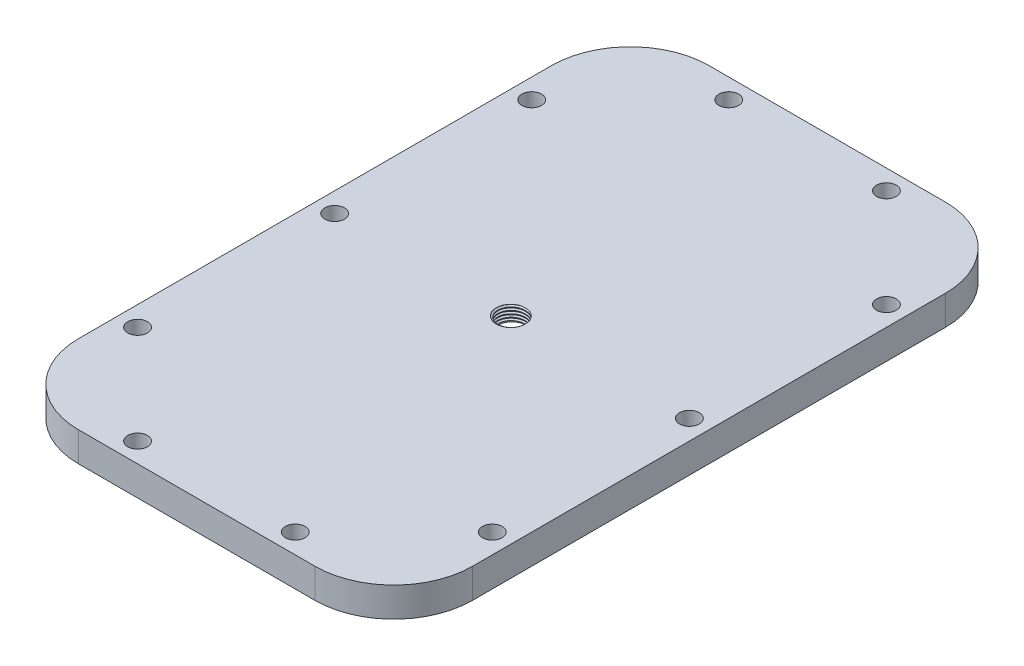
from build123d import *

# Parameters (mm, degrees)
BOSS_EXTRUDE1_DEPTH = 15
CUT_EXTRUDE1_DEPTH  = 7.5
SKETCH3_R           = 6.92
CUT_EXTRUDE2_DEPTH  = 7.5
SKETCH4_R           = 5
CUT_EXTRUDE3_DEPTH  = 15
THREAD1_PITCH       = 1.5


with BuildPart() as part:
    # Sketch1 → Boss-Extrude1 (new body)
    with BuildSketch(Plane(origin=(0, 0, 0), x_dir=(1, 0, 0), z_dir=(0, 1, 0))):
        with BuildLine():
            Line((-100, -120), (-100, 120))
            ThreePointArc((-100, 120), (-88.284271247, 148.284271247), (-60, 160))
            Line((-60, 160), (60, 160))
            ThreePointArc((60, 160), (88.284271247, 148.284271247), (100, 120))
            Line((100, 120), (100, -120))
            ThreePointArc((100, -120), (88.284271247, -148.284271247), (60, -160))
            Line((60, -160), (-60, -160))
            ThreePointArc((-60, -160), (-88.284271247, -148.284271247), (-100, -120))
        make_face()
    extrude(amount=BOSS_EXTRUDE1_DEPTH)

    # Sketch2 → Cut-Extrude1 (cut)
    with BuildSketch(Plane.XZ):
        with BuildLine():
            Line((80, -120), (80, 120))
            ThreePointArc((80, 120), (74.142135624, 134.142135624), (60, 140))
            Line((60, 140), (-60, 140))
            ThreePointArc((-60, 140), (-74.142135624, 134.142135624), (-80, 120))
            Line((-80, 120), (-80, -120))
            ThreePointArc((-80, -120), (-74.142135624, -134.142135624), (-60, -140))
            Line((-60, -140), (60, -140))
            ThreePointArc((60, -140), (74.142135624, -134.142135624), (80, -120))
        make_face()
    extrude(amount=-CUT_EXTRUDE1_DEPTH, mode=Mode.SUBTRACT)

    # Sketch3 → Cut-Extrude2 (cut)
    with BuildSketch(Plane.XZ.offset(-7.5)):
        with Locations(Location((0, 0, 0), (0, 0, 270))):
            Circle(SKETCH3_R)
    extrude(amount=-CUT_EXTRUDE2_DEPTH, mode=Mode.SUBTRACT)

    # Sketch4 → Cut-Extrude3 (cut)
    with BuildSketch(Plane.XZ):
        with Locations(Location((40, 150, 0), (0, 0, 270))):
            Circle(SKETCH4_R)
        with Locations(Location((90, 0, 0), (0, 0, 270))):
            Circle(SKETCH4_R)
        with Locations(Location((90, 100, 0), (0, 0, 270))):
            Circle(SKETCH4_R)
        with Locations(Location((90, -100, 0), (0, 0, 270))):
            Circle(SKETCH4_R)
        with Locations(Location((40, -150, 0), (0, 0, 270))):
            Circle(SKETCH4_R)
        with Locations(Location((-40, -150, 0), (0, 0, 270))):
            Circle(SKETCH4_R)
        with Locations(Location((-90, -100, 0), (0, 0, 270))):
            Circle(SKETCH4_R)
        with Locations(Location((-90, 100, 0), (0, 0, 270))):
            Circle(SKETCH4_R)
        with Locations(Location((-90, 0, 0), (0, 0, 270))):
            Circle(SKETCH4_R)
        with Locations(Location((-40, 150, 0), (0, 0, 270))):
            Circle(SKETCH4_R)
    extrude(amount=-CUT_EXTRUDE3_DEPTH, mode=Mode.SUBTRACT)

    # Thread1: the profile of Thread Profile1 profile screwed along a right-hand helix of 5 turns, 8 arcs to a turn; built about Z, then put on its axis
    thread1_z = Axis((0, 0, 0), (0, 0, 1))
    thread1_corners = [(6.9197, 0, -0.000173205), (7.731898812, 0, 0.468749998), (7.731898812, 0, 0.656249998), (6.9197, 0, 1.125173201)]
    with BuildLine(mode=Mode.PRIVATE) as thread1_profile:
        Line(thread1_corners[0], thread1_corners[1])
        Line(thread1_corners[1], thread1_corners[2])
        Line(thread1_corners[2], thread1_corners[3])
        Line(thread1_corners[3], thread1_corners[0])
    thread1_cap = Face(thread1_profile.wire())
    thread1_turn_angles = [0, 22.5, 45, 67.5, 90, 112.5, 135, 157.5, 180, 202.5, 225, 247.5, 270, 292.5, 315, 337.5, 360]
    thread1_turn_weights = [1, 0.9238795325112867, 1, 0.9238795325112867, 1, 0.9238795325112867, 1, 0.9238795325112867, 1, 0.9238795325112867, 1, 0.9238795325112867, 1, 0.9238795325112867, 1, 0.9238795325112867, 1]
    thread1_turn_rails = [Edge.make_bspline([Vector(p[0], p[1], 0).rotate(thread1_z, thread1_turn_angles[k]) / thread1_turn_weights[k] + Vector(0, 0, p[2] + THREAD1_PITCH * thread1_turn_angles[k] / 360) for k in range(17)], [0, 0, 0, 1, 1, 2, 2, 3, 3, 4, 4, 5, 5, 6, 6, 7, 7, 8, 8, 8], 2, thread1_turn_weights) for p in thread1_corners]
    thread1_turn_sides = [Face.make_surface_from_curves(thread1_turn_rails[p[0]], thread1_turn_rails[p[1]]) for p in [(0, 1), (1, 2), (2, 3), (3, 0)]]
    thread1 = Plane(origin=(0, 7.5, 0), x_dir=(1, 0, 0), z_dir=(0, 1, 0)) * Solid(Shell([*[p.moved(Location((0, 0, THREAD1_PITCH * i))) for i in range(5) for p in thread1_turn_sides], thread1_cap, thread1_cap.rotate(thread1_z, 1800).moved(Location((0, 0, THREAD1_PITCH * 1800 / 360)))]))
    add(thread1, mode=Mode.SUBTRACT)


solid = part.part
